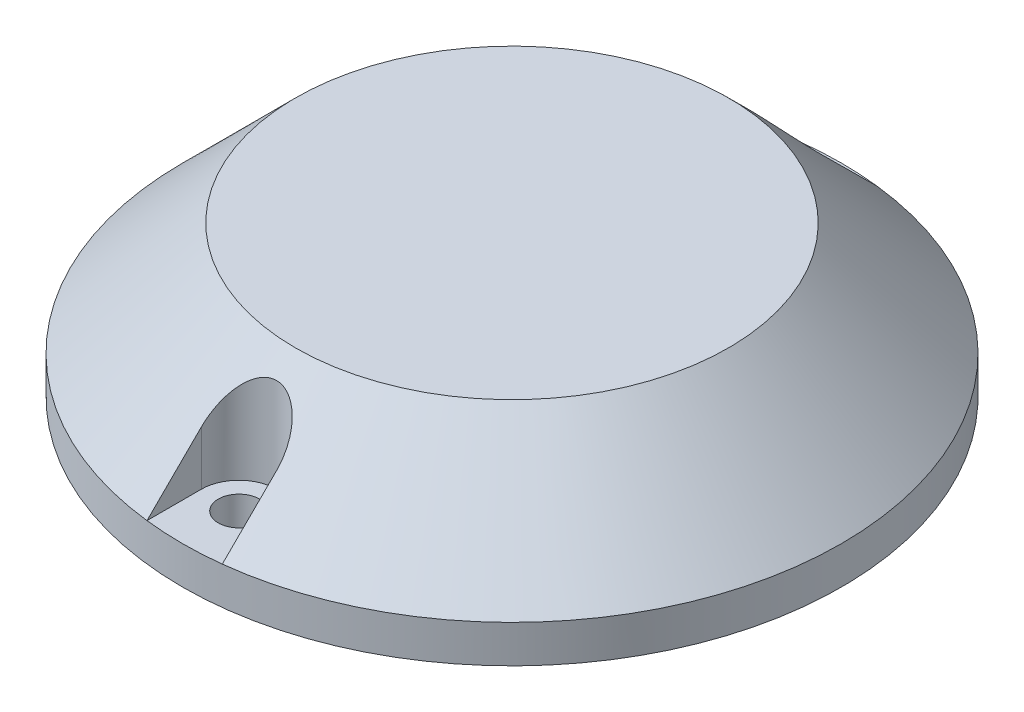
from build123d import *
from build123d.topology import SkipClean

# Parameters (mm, degrees)
BOSS_EXTRUDE1_DEPTH = 2
SKETCH2_R           = 11.5
BOSS_EXTRUDE2_DEPTH = 6
CHAMFER1_START      = 2
CHAMFER1_2_DEPTH    = 6
SKETCH6_R           = 17.5
SKETCH6_R_2         = 1.1
BOSS_EXTRUDE3_DEPTH = 2
SKETCH7_R           = 11.5
CUT_EXTRUDE1_DEPTH  = 7
CHAMFER2_SIZE       = 1.5
CHAMFER3_SIZE       = 1


with BuildPart() as part:
    # Sketch1 → Boss-Extrude1 (new body)
    with BuildSketch(Plane(origin=(0, 0, 0), x_dir=(1, 0, 0), z_dir=(0, 1, 0))):
        with BuildLine():
            Line((-2, 14.5), (-2, 17.385338651))
            ThreePointArc((-2, 17.385338651), (-17.5, 0), (-2, -17.385338651))
            Line((-2, -17.385338651), (-2, -14.5))
            ThreePointArc((-2, -14.5), (0, -12.5), (2, -14.5))
            Line((2, -14.5), (2, -17.385338651))
            ThreePointArc((2, -17.385338651), (17.5, 0), (2, 17.385338651))
            Line((2, 17.385338651), (2, 14.5))
            ThreePointArc((2, 14.5), (0, 12.5), (-2, 14.5))
        make_face()
    extrude(amount=BOSS_EXTRUDE1_DEPTH)

    # Sketch2 → Boss-Extrude2 (add)
    with BuildSketch(Plane(origin=(0, 2, 0), x_dir=(1, 0, 0), z_dir=(0, 1, 0))):
        with Locations(Location((0, 0, 0), (0, 0, 270))):
            Circle(SKETCH2_R)
    extrude(amount=BOSS_EXTRUDE2_DEPTH)

    # Chamfer1: read off the stored shape, not the designer's step
    # Chamfer1 outline → Chamfer1 (revolve)
    with BuildSketch(Plane.XY):
        Polygon((17.5, 2), (11.5, 8), (11.5, 2), align=None)
    revolve(axis=Axis((0, 0, 0), (0, 1, 0)))

    # Chamfer1 2 outline → Chamfer1 2 (cut)
    with BuildSketch(Plane(origin=(0, 0, 0), x_dir=(1, 0, 0), z_dir=(0, 1, 0)).offset(CHAMFER1_START)):
        with BuildLine():
            ThreePointArc((2, -14.5), (0, -12.5), (-2, -14.5))
            Line((-2, -14.5), (-2, -19))
            Line((-2, -19), (2, -19))
            Line((2, -19), (2, -14.5))
        make_face()
        with BuildLine():
            Line((2, 19), (-2, 19))
            Line((-2, 19), (-2, 14.5))
            ThreePointArc((-2, 14.5), (0, 12.5), (2, 14.5))
            Line((2, 14.5), (2, 19))
        make_face()
    extrude(amount=CHAMFER1_2_DEPTH, mode=Mode.SUBTRACT)

    # Sketch6 → Boss-Extrude3 (add)
    with SkipClean():  # the faces are left unmerged after this step: merging them gives an invalid solid
        with BuildSketch(Plane.XZ):
            with Locations(Location((0, 0, 0), (0, 0, 263.437572131))):
                Circle(SKETCH6_R)
            with Locations(Location((0, 14.5, 0), (0, 0, 270))):
                Circle(SKETCH6_R_2, mode=Mode.SUBTRACT)
            with Locations(Location((0, -14.5, 0), (0, 0, 270))):
                Circle(SKETCH6_R_2, mode=Mode.SUBTRACT)
        extrude(amount=-BOSS_EXTRUDE3_DEPTH)

    # Sketch7 → Cut-Extrude1 (cut)
    with SkipClean():  # the faces are left unmerged after this step: merging them gives an invalid solid
        with BuildSketch(Plane.XZ):
            with Locations(Location((0, 0, 0), (0, 0, 270))):
                Circle(SKETCH7_R)
        extrude(amount=-CUT_EXTRUDE1_DEPTH, mode=Mode.SUBTRACT)

    # Chamfer2
    chamfer2_edges = [part.edges().sort_by_distance(p)[0] for p in [
        (0, 7, 11.5),
    ]]
    chamfer(chamfer2_edges, length=CHAMFER2_SIZE)

    # Chamfer3
    chamfer3_edges = [part.edges().sort_by_distance(p)[0] for p in [
        (0, 0, 11.5),
    ]]
    chamfer(chamfer3_edges, length=CHAMFER3_SIZE - 0.0001)  # a hair under: the kernel refuses the full size


solid = part.part
